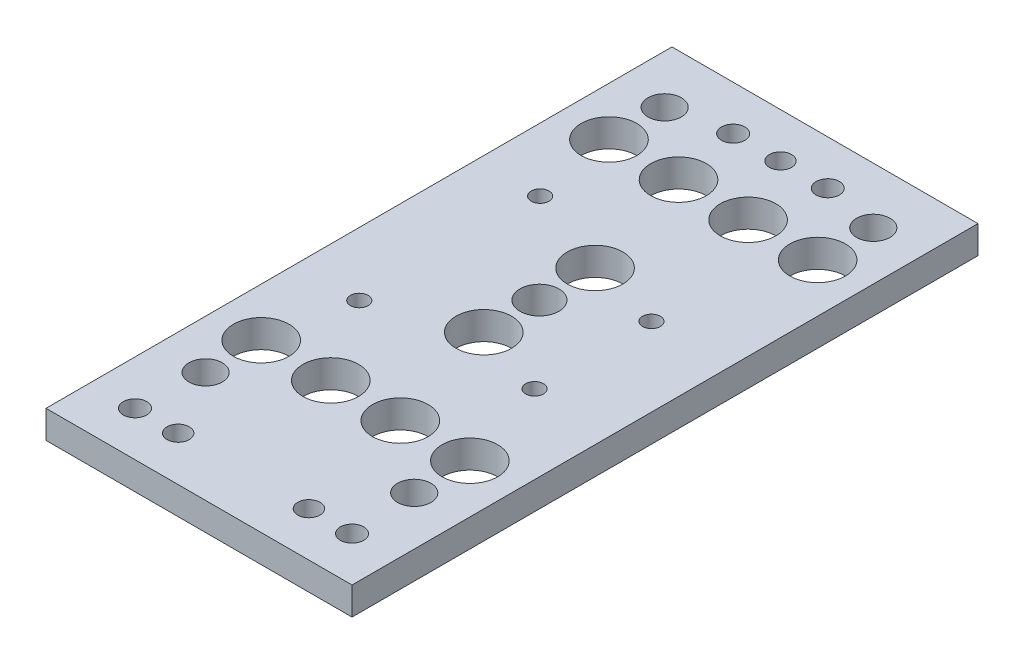
from build123d import *

# Parameters (mm, degrees)
SKETCH1_W             = 110
SKETCH1_H             = 225
BOSS_EXTRUDE1_DEPTH   = 10
M8_CLEARANCE_HOLE1_D  = 8.4
F_8_0MM_DOWEL_HOLE1_D = 8
CUT_EXTRUDE1_REACH    = 127.623
SKETCH8_R             = 7
M6_CLEARANCE_HOLE1_D  = 6.4
SKETCH14_R            = 10
CUT_EXTRUDE2_DEPTH    = 126.623445264
SKETCH15_R            = 6
CUT_EXTRUDE3_DEPTH    = 126.623445264


with BuildPart() as part:
    # Sketch1 → Boss-Extrude1 (new body)
    with BuildSketch(Plane(origin=(0, 0, 0), x_dir=(1, 0, 0), z_dir=(0, 1, 0))):
        Rectangle(SKETCH1_W, SKETCH1_H)
    extrude(amount=-BOSS_EXTRUDE1_DEPTH)

    # M8 Clearance Hole1 (through all)
    with Locations(Plane(origin=(0, 0, 0), x_dir=(1, 0, 0), z_dir=(0, 1, 0))):
        with Locations((-17, 96.5), (17, 96.5), (-39, -96.5), (39, -96.5)):
            Hole(M8_CLEARANCE_HOLE1_D / 2)

    # Ø8.0mm Dowel Hole1 (through all)
    with Locations(Plane(origin=(0, 0, 0), x_dir=(1, 0, 0), z_dir=(0, 1, 0))):
        with Locations((0, 96.5), (-23.5, -96.5), (23.5, -96.5)):
            Hole(F_8_0MM_DOWEL_HOLE1_D / 2)

    # Sketch8 → Cut-Extrude1 (cut, up to next)
    with BuildSketch(Plane(origin=(0, 0, 0), x_dir=(1, 0, 0), z_dir=(0, 1, 0)), mode=Mode.PRIVATE) as cut_extrude1_sk1:
        with Locations((0, 9.86)):
            Circle(SKETCH8_R)
    cut_extrude1_tool1 = extrude(cut_extrude1_sk1.sketch, amount=-CUT_EXTRUDE1_REACH, mode=Mode.PRIVATE) & part.part
    add(cut_extrude1_tool1.solids().sort_by_distance((0, 0, -9.86))[0], mode=Mode.SUBTRACT)

    # M6 Clearance Hole1 (through all)
    with Locations(Plane(origin=(0, 0, 0), x_dir=(1, 0, 0), z_dir=(0, 1, 0))):
        with Locations((26.75, 23.36), (26.75, -18.64), (-32.25, 42.36), (-32.25, -22.64)):
            Hole(M6_CLEARANCE_HOLE1_D / 2)

    # Sketch14 → Cut-Extrude2 (cut, through all)
    with BuildSketch(Plane(origin=(0, 0, 0), x_dir=(1, 0, 0), z_dir=(0, 1, 0))):
        with Locations((37.5, 72.36)):
            Circle(SKETCH14_R)
        with Locations((12.5, 72.36)):
            Circle(SKETCH14_R)
        with Locations((-12.5, 72.36)):
            Circle(SKETCH14_R)
        with Locations((-37.5, 72.36)):
            Circle(SKETCH14_R)
        with Locations((0, 29.86)):
            Circle(SKETCH14_R)
        with Locations((0, -10.14)):
            Circle(SKETCH14_R)
        with Locations((37.5, -52.64)):
            Circle(SKETCH14_R)
        with Locations((12.5, -52.64)):
            Circle(SKETCH14_R)
        with Locations((-12.5, -52.64)):
            Circle(SKETCH14_R)
        with Locations((-37.5, -52.64)):
            Circle(SKETCH14_R)
    extrude(amount=-CUT_EXTRUDE2_DEPTH, mode=Mode.SUBTRACT)

    # Sketch15 → Cut-Extrude3 (cut, through all)
    with BuildSketch(Plane(origin=(0, 0, 0), x_dir=(1, 0, 0), z_dir=(0, 1, 0))):
        with Locations((37.5, -72.64)):
            Circle(SKETCH15_R)
        with Locations((-37.5, -72.64)):
            Circle(SKETCH15_R)
        with Locations((-37.5, 92.36)):
            Circle(SKETCH15_R)
        with Locations((37.5, 92.36)):
            Circle(SKETCH15_R)
    extrude(amount=-CUT_EXTRUDE3_DEPTH, mode=Mode.SUBTRACT)


solid = part.part
